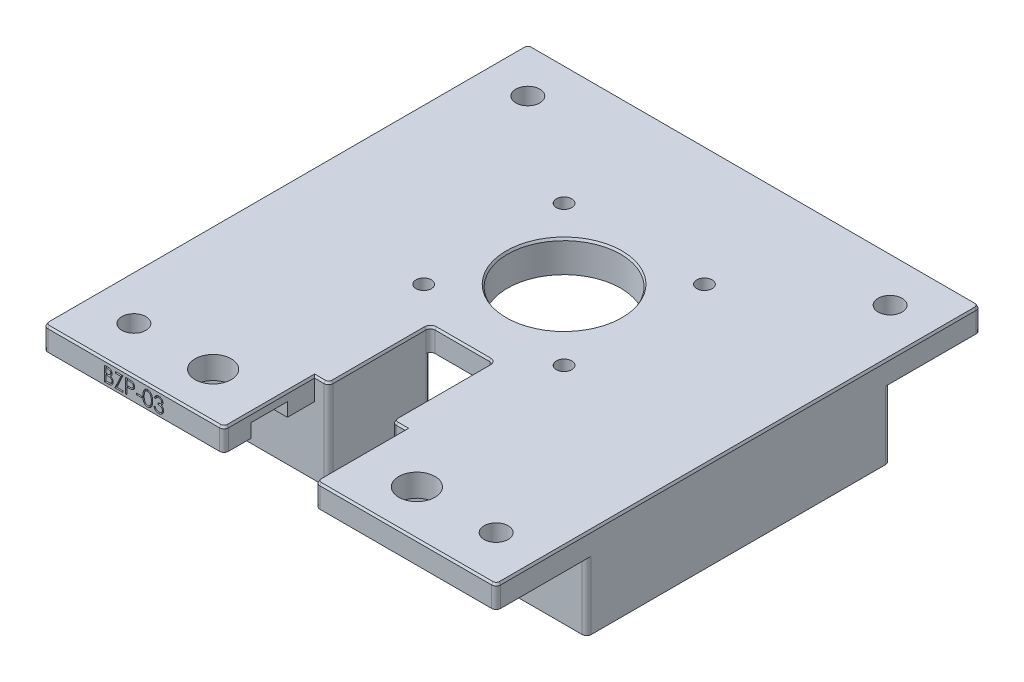
from build123d import *
from OCP.BRepFilletAPI import BRepFilletAPI_MakeChamfer

# Parameters (mm, degrees)
SKETCH2_W                  = 100
SKETCH2_H                  = 107
BOSS_EXTRUDE1_DEPTH        = 5
CUT_EXTRUDE1_DEPTH         = 147.540096902
CUT_EXTRUDE1_DEPTH_BACK    = 147.540096902
SKETCH3_R                  = 12.5
SKETCH3_R_2                = 1.7
SKETCH3_R_3                = 4
M5_CLEARANCE_HOLE1_D       = 5.3
FILLET1_R                  = 1
BOSS_EXTRUDE2_DEPTH        = 15
FILLET3_R                  = 3
FILLET4_R                  = 1
CUT_EXTRUDE2_DEPTH         = 4
CUT_EXTRUDE2_DEPTH_BACK    = 4
SKETCH12_R                 = 12.5
SKETCH12_R_2               = 1.7
BOSS_EXTRUDE3_DEPTH        = 2
CHAMFER2_SIZE              = 0.5
SKETCH10_W                 = 1.221153846
SKETCH10_H                 = 0.325641026
PART_NUM_DEPTH             = 0.4
PRINTABILITY_CHAMFER_SIZE  = 0.5
PRINTABILITY_CHAMFER_SIZE2 = 0.288675135


with BuildPart() as part:
    # Sketch2 → Boss-Extrude1 (new body)
    with BuildSketch(Plane(origin=(0, 0, 0), x_dir=(1, 0, 0), z_dir=(0, 1, 0))):
        with Locations((50, 53.5)):
            Rectangle(SKETCH2_W, SKETCH2_H)
    extrude(amount=BOSS_EXTRUDE1_DEPTH)

    # Sketch3 → Cut-Extrude1 (cut, two sides: drawn at the far end of the back side and taken through both)
    with BuildSketch(Plane(origin=(0, 5, 0), x_dir=(1, 0, 0), z_dir=(0, 1, 0)).offset(-CUT_EXTRUDE1_DEPTH_BACK)):
        with Locations((50, 65)):
            Circle(SKETCH3_R)
        with Locations((65.5, 49.5)):
            Circle(SKETCH3_R_2)
        with Locations((34.5, 49.5)):
            Circle(SKETCH3_R_2)
        with Locations((65.5, 80.5)):
            Circle(SKETCH3_R_2)
        with Locations((34.5, 80.5)):
            Circle(SKETCH3_R_2)
        with Locations((27.5, 10)):
            Circle(SKETCH3_R_3)
        with Locations((72.5, 10)):
            Circle(SKETCH3_R_3)
        Polygon((39.9, 0), (39.9, 20), (43, 20), (43, 42.5), (57, 42.5), (57, 20), (60.1, 20), (60.1, 0), align=None)
    extrude(amount=CUT_EXTRUDE1_DEPTH + CUT_EXTRUDE1_DEPTH_BACK, mode=Mode.SUBTRACT)

    # M5 Clearance Hole1 (through all)
    with Locations(Plane(origin=(0, 5, 0), x_dir=(1, 0, 0), z_dir=(0, 1, 0))):
        with Locations((10, 97), (10, 10), (90, 10), (90, 97)):
            Hole(M5_CLEARANCE_HOLE1_D / 2)

    # Fillet1
    fillet1_edges = [part.edges().sort_by_distance(p)[0] for p in [
        (60.1, 2.5, 0),
        (39.9, 2.5, 0),
        (0, 2.5, -107),
        (100, 2.5, -107),
        (100, 2.5, 0),
        (0, 2.5, 0),
        (57, 2.5, -42.5),
        (43, 2.5, -42.5),
    ]]
    fillet(fillet1_edges, radius=FILLET1_R)

    # Sketch7 → Boss-Extrude2 (add)
    with BuildSketch(Plane.XZ):
        Polygon((57, -20), (100, -20), (100, -87), (84, -87), (84, -82), (95, -82), (95, -25), (62, -25), (62, -42.5), (57, -42.5), (57, -25), align=None)
        Polygon((43, -25), (43, -20), (0, -20), (0, -87), (16, -87), (16, -82), (5, -82), (5, -25), (38, -25), (38, -42.5), (43, -42.5), align=None)
    extrude(amount=BOSS_EXTRUDE2_DEPTH)

    # Fillet3
    fillet3_edges = [part.edges().sort_by_distance(p)[0] for p in [
        (5, -7.5, -82),
        (95, -7.5, -82),
        (5, -7.5, -25),
        (38, -7.5, -25),
        (95, -7.5, -25),
        (62, -7.5, -25),
    ]]
    fillet(fillet3_edges, radius=FILLET3_R)

    # Fillet4
    fillet4_edges = [part.edges().sort_by_distance(p)[0] for p in [
        (100, -7.5, -87),
        (100, -7.5, -20),
        (43, -5, -20),
        (57, -5, -20),
        (84, -7.5, -87),
        (84, -7.5, -82),
        (0, -7.5, -20),
        (0, -7.5, -87),
        (16, -7.5, -87),
        (16, -7.5, -82),
        (38, -7.5, -42.5),
        (62, -7.5, -42.5),
        (57, -7.5, -42.5),
        (43, -7.5, -42.5),
    ]]
    fillet(fillet4_edges, radius=FILLET4_R)

    # Sketch9 → Cut-Extrude2 (cut, two sides: drawn at the far end of the back side and taken through both)
    with BuildSketch(Plane.XY.offset(-10).offset(-CUT_EXTRUDE2_DEPTH_BACK)):
        Polygon((39.9, 0), (39.9, 3), (36.9, 0), align=None)
        Polygon((60.1, 0), (63.1, 0), (60.1, 3), align=None)
    extrude(amount=CUT_EXTRUDE2_DEPTH + CUT_EXTRUDE2_DEPTH_BACK, mode=Mode.SUBTRACT)

    # Sketch12 → Boss-Extrude3 (add)
    with BuildSketch(Plane.XZ):
        with BuildLine():
            Line((34.5, -85.5), (65.5, -85.5))
            ThreePointArc((65.5, -85.5), (69.035533906, -84.035533906), (70.5, -80.5))
            Line((70.5, -80.5), (70.5, -49.5))
            ThreePointArc((70.5, -49.5), (69.035533906, -45.964466094), (65.5, -44.5))
            Line((65.5, -44.5), (34.5, -44.5))
            ThreePointArc((34.5, -44.5), (30.964466094, -45.964466094), (29.5, -49.5))
            Line((29.5, -49.5), (29.5, -80.5))
            ThreePointArc((29.5, -80.5), (30.964466094, -84.035533906), (34.5, -85.5))
        make_face()
        with Locations((50, -65)):
            Circle(SKETCH12_R, mode=Mode.SUBTRACT)
        with Locations((34.5, -49.5)):
            Circle(SKETCH12_R_2, mode=Mode.SUBTRACT)
        with Locations((65.5, -49.5)):
            Circle(SKETCH12_R_2, mode=Mode.SUBTRACT)
        with Locations((65.5, -80.5)):
            Circle(SKETCH12_R_2, mode=Mode.SUBTRACT)
        with Locations((34.5, -80.5)):
            Circle(SKETCH12_R_2, mode=Mode.SUBTRACT)
    extrude(amount=BOSS_EXTRUDE3_DEPTH)

    # Chamfer2
    chamfer2_edges = [part.edges().sort_by_distance(p)[0] for p in [
        (50, 0, -85.5),
        (69.035533906, 0, -84.035533906),
        (30.964466094, 0, -84.035533906),
        (70.5, 0, -65),
        (29.5, 0, -65),
        (69.035533906, 0, -45.964466094),
        (30.964466094, 0, -45.964466094),
        (50, 0, -44.5),
    ]]
    chamfer(chamfer2_edges, length=CHAMFER2_SIZE)

    # Sketch10 → Part Num (cut)
    # profile 1 of 6: a face of its own
    with BuildSketch(Plane(origin=(0, 5, 0), x_dir=(1, 0, 0), z_dir=(0, 0, -1))):
        with BuildLine():
            Line((13.559294872, 1.225), (14.178776042, 1.225))
            add(Edge.make_bspline(
                [(14.178776042, 1.225), (14.209100925, 1.225156921), (14.267878096, 1.225461072), (14.353342091, 1.230287737), (14.433418884, 1.236704332), (14.50796697, 1.247467824), (14.577471422, 1.258628146), (14.641226624, 1.275008826), (14.699766605, 1.293101885), (14.77006114, 1.32094051), (14.849819923, 1.364174247), (14.93554569, 1.428293986), (15.010063757, 1.505168377), (15.073426203, 1.592772808), (15.124275913, 1.68914761), (15.160598035, 1.792219247), (15.18393275, 1.900253662), (15.186302411, 1.974321243), (15.1875, 2.011753806)],
                knots=[0, 0, 0, 0, 1.00128172, 1.940733171, 2.826250472, 3.653024905, 4.427672124, 5.149348099, 5.824709082, 6.450061444, 7.643590664, 8.808605388, 9.972104426, 11.165284501, 12.367876273, 13.557044126, 14.765369432, 16, 16, 16, 16], degree=3))
            add(Edge.make_bspline(
                [(15.1875, 2.011753806), (15.186521793, 2.046821674), (15.184599523, 2.115733341), (15.165820503, 2.216186738), (15.137474028, 2.312110727), (15.096568342, 2.402580893), (15.044410156, 2.486802276), (14.980951884, 2.563338275), (14.905707767, 2.630686236), (14.849214068, 2.668166335), (14.820517829, 2.687204527)],
                knots=[0, 0, 0, 0, 1.044356178, 2.052258378, 3.035953355, 4.020338374, 5.002448483, 5.980768927, 6.974322109, 8, 8, 8, 8], degree=3))
            add(Edge.make_bspline(
                [(14.820517829, 2.687204527), (14.856588776, 2.701045853), (14.925601434, 2.727527739), (15.020694663, 2.77452874), (15.102651573, 2.825257679), (15.172528364, 2.880086384), (15.231080178, 2.940805168), (15.283240485, 3.005814962), (15.327507334, 3.077379834), (15.365276832, 3.153949009), (15.395196276, 3.235117005), (15.415964531, 3.320276589), (15.429135825, 3.40846321), (15.430858211, 3.468399436), (15.431730769, 3.498763021)],
                knots=[0, 0, 0, 0, 1.272200328, 2.434034374, 3.488177493, 4.442517805, 5.351202203, 6.260825393, 7.183200622, 8.11705787, 9.069326169, 10.026320267, 11.000137371, 12, 12, 12, 12], degree=3))
            add(Edge.make_bspline(
                [(15.431730769, 3.498763021), (15.430844545, 3.529757203), (15.429100875, 3.590739126), (15.41623883, 3.680324877), (15.394454675, 3.765933729), (15.364470848, 3.848135531), (15.325385419, 3.926448851), (15.27816616, 4.001489144), (15.22149309, 4.072144303), (15.157673639, 4.13943962), (15.086469492, 4.20097828), (15.008008094, 4.253862582), (14.924300327, 4.299540927), (14.834199915, 4.336263754), (14.73834618, 4.365011011), (14.636716669, 4.384886817), (14.529369089, 4.398332925), (14.455699174, 4.399434879), (14.41791867, 4.4)],
                knots=[0, 0, 0, 0, 0.978522333, 1.925270105, 2.85076145, 3.763600118, 4.682725947, 5.609499657, 6.557784645, 7.537954401, 8.534920712, 9.522742111, 10.520247711, 11.5409147, 12.58930695, 13.675078472, 14.807699069, 16, 16, 16, 16], degree=3))
            Line((14.41791867, 4.4), (13.559294872, 4.4))
            Line((13.559294872, 4.4), (13.559294872, 1.225))
        make_face()
        with BuildLine():
            Line((13.844230769, 1.550641026), (13.844230769, 2.568269231))
            Line((13.844230769, 2.568269231), (14.035672075, 2.568269231))
            add(Edge.make_bspline(
                [(14.035672075, 2.568269231), (14.063656592, 2.567909462), (14.11772838, 2.567214317), (14.196240951, 2.565160292), (14.26893695, 2.559660798), (14.336066859, 2.553844164), (14.397180797, 2.544887778), (14.452483186, 2.53392756), (14.502471365, 2.522437825), (14.560090796, 2.502841292), (14.625441111, 2.474182831), (14.694618633, 2.428618136), (14.756881512, 2.375864071), (14.808244794, 2.313289506), (14.85100659, 2.245714635), (14.879796447, 2.172635549), (14.899869806, 2.096570575), (14.901656804, 2.044112234), (14.902564103, 2.017477965)],
                knots=[0, 0, 0, 0, 1.156584208, 2.234756387, 3.244705828, 4.168772894, 5.018724976, 5.795346628, 6.498686023, 7.135894168, 8.308330183, 9.43588092, 10.547699294, 11.667188675, 12.76860303, 13.837480448, 14.902040606, 16, 16, 16, 16], degree=3))
            add(Edge.make_bspline(
                [(14.902564103, 2.017477965), (14.902121598, 1.999845497), (14.901253578, 1.965257486), (14.893070408, 1.914864741), (14.88177773, 1.866910763), (14.863153292, 1.822688306), (14.841088146, 1.780644538), (14.8128059, 1.742107543), (14.780193868, 1.706033348), (14.742172327, 1.673388889), (14.698896699, 1.64386386), (14.648996117, 1.619285683), (14.593827254, 1.597443357), (14.532239669, 1.580886362), (14.465460128, 1.566512255), (14.392469815, 1.557448022), (14.313708618, 1.551625016), (14.259137987, 1.550976338), (14.230929487, 1.550641026)],
                knots=[0, 0, 0, 0, 0.911412742, 1.787835618, 2.63643285, 3.453173233, 4.262886967, 5.08783453, 5.918594724, 6.773969545, 7.67442701, 8.62112486, 9.645634318, 10.739428598, 11.916091468, 13.177237585, 14.540865421, 16, 16, 16, 16], degree=3))
            Line((14.230929487, 1.550641026), (13.844230769, 1.550641026))
        make_face(mode=Mode.SUBTRACT)
        with BuildLine():
            Line((13.844230769, 2.893910256), (13.844230769, 4.074358974))
            Line((13.844230769, 4.074358974), (14.250010016, 4.074358974))
            add(Edge.make_bspline(
                [(14.250010016, 4.074358974), (14.279052852, 4.073977387), (14.335029091, 4.073241928), (14.415910647, 4.071496784), (14.490477252, 4.065022306), (14.55934975, 4.058814977), (14.622209475, 4.048674015), (14.679667845, 4.038854064), (14.730412484, 4.024403522), (14.789786642, 4.00451932), (14.856196042, 3.97274173), (14.92871824, 3.926010062), (14.99259521, 3.869087446), (15.046790344, 3.803544285), (15.091851221, 3.733014359), (15.123024449, 3.657358853), (15.143222926, 3.579104783), (15.145601826, 3.52559752), (15.146794872, 3.498763021)],
                knots=[0, 0, 0, 0, 1.16016216, 2.236059617, 3.229676189, 4.14889023, 4.996733752, 5.772278665, 6.474820656, 7.101410824, 8.271817372, 9.403828207, 10.537358096, 11.673541442, 12.791884111, 13.865947414, 14.929748409, 16, 16, 16, 16], degree=3))
            add(Edge.make_bspline(
                [(15.146794872, 3.498763021), (15.146551335, 3.481984403), (15.146068189, 3.448697807), (15.138473614, 3.399825141), (15.127934288, 3.352248989), (15.11240228, 3.306615593), (15.093612775, 3.262139153), (15.06882463, 3.220266851), (15.040863787, 3.17921625), (14.997556668, 3.126707986), (14.933707118, 3.066939881), (14.842942728, 3.009154389), (14.740317485, 2.961797377), (14.665709188, 2.941777202), (14.62716847, 2.931435296)],
                knots=[0, 0, 0, 0, 0.723354195, 1.435040621, 2.129761981, 2.824182007, 3.512608497, 4.209435533, 4.920062464, 5.654614313, 7.143585817, 8.671381114, 10.280521501, 12, 12, 12, 12], degree=3))
            add(Edge.make_bspline(
                [(14.62716847, 2.931435296), (14.611720661, 2.928300831), (14.578226627, 2.921504664), (14.523609473, 2.914335298), (14.461047138, 2.907904144), (14.390807025, 2.903271916), (14.31260978, 2.898299301), (14.226480524, 2.896434267), (14.132358367, 2.894157894), (14.067050921, 2.893994914), (14.033128005, 2.893910256)],
                knots=[0, 0, 0, 0, 0.634452549, 1.375623993, 2.216454381, 3.166361212, 4.209414599, 5.370755378, 6.634280627, 8, 8, 8, 8], degree=3))
            Line((14.033128005, 2.893910256), (13.844230769, 2.893910256))
        make_face(mode=Mode.SUBTRACT)
    # profile 2 of 6: a face of its own
    with BuildSketch(Plane(origin=(0, 5, 0), x_dir=(1, 0, 0), z_dir=(0, 0, -1))):
        Polygon((15.920192308, 1.550641026), (15.920192308, 1.225), (17.589102564, 1.225), (16.257281651, 4.074358974), (17.548397436, 4.074358974), (17.548397436, 4.4), (15.798076923, 4.4), (17.129897837, 1.550641026), align=None)
    # profile 3 of 6: a face of its own
    with BuildSketch(Plane(origin=(0, 5, 0), x_dir=(1, 0, 0), z_dir=(0, 0, -1))):
        with BuildLine():
            Line((18.199679487, 1.225), (18.822340745, 1.225))
            add(Edge.make_bspline(
                [(18.822340745, 1.225), (18.865167781, 1.225047077), (18.947226285, 1.22513728), (19.064896371, 1.227872085), (19.171766628, 1.23152487), (19.267606616, 1.236588444), (19.352711219, 1.242572494), (19.426695341, 1.250965415), (19.49014051, 1.259728683), (19.528155646, 1.268638102), (19.545492788, 1.272701322)],
                knots=[0, 0, 0, 0, 1.415646017, 2.712440637, 3.8905458, 4.950247383, 5.884950622, 6.709939814, 7.411656543, 8, 8, 8, 8], degree=3))
            add(Edge.make_bspline(
                [(19.545492788, 1.272701322), (19.56743964, 1.278708558), (19.610816194, 1.290581476), (19.673321301, 1.314358446), (19.732780513, 1.342564145), (19.789442546, 1.374662729), (19.842336712, 1.412170044), (19.89311447, 1.452921295), (19.940710937, 1.498564559), (19.984407421, 1.549039743), (20.024894101, 1.6026933), (20.058784353, 1.660893367), (20.08871078, 1.721620959), (20.112032716, 1.78635876), (20.130364655, 1.854252238), (20.143715825, 1.9254781), (20.152296908, 1.999882695), (20.153111145, 2.050738752), (20.153525641, 2.076627604)],
                knots=[0, 0, 0, 0, 0.999333726, 1.975119402, 2.933498163, 3.889020618, 4.832249799, 5.779334906, 6.747801194, 7.724875447, 8.710438469, 9.696133548, 10.679360639, 11.681339199, 12.714023775, 13.766351759, 14.862936069, 16, 16, 16, 16], degree=3))
            add(Edge.make_bspline(
                [(20.153525641, 2.076627604), (20.153143349, 2.102733159), (20.152395368, 2.15381044), (20.143418023, 2.228534326), (20.131325635, 2.299943151), (20.11273188, 2.367878582), (20.08837902, 2.431937173), (20.059811229, 2.493097862), (20.025354741, 2.550320136), (19.985762645, 2.603811736), (19.941719413, 2.65362287), (19.893411391, 2.699392577), (19.841033604, 2.740852941), (19.784752512, 2.77809691), (19.724019435, 2.810260821), (19.659755482, 2.839069233), (19.591402071, 2.863263695), (19.544101362, 2.875990965), (19.520052083, 2.882461939)],
                knots=[0, 0, 0, 0, 1.121902311, 2.195077645, 3.232258892, 4.234102512, 5.217864754, 6.176164875, 7.132989551, 8.084763148, 9.034132444, 9.988522005, 10.94243251, 11.903244335, 12.886203696, 13.894208494, 14.929344452, 16, 16, 16, 16], degree=3))
            add(Edge.make_bspline(
                [(19.520052083, 2.882461939), (19.500160632, 2.886688777), (19.456567361, 2.895952137), (19.384778108, 2.906363894), (19.301151672, 2.914902673), (19.205972588, 2.922871129), (19.0990189, 2.927093415), (18.980535909, 2.932051068), (18.850122628, 2.934390313), (18.759163431, 2.934538182), (18.711673678, 2.934615385)],
                knots=[0, 0, 0, 0, 0.601372724, 1.317943291, 2.144091499, 3.08771165, 4.142394186, 5.309582461, 6.595334295, 8, 8, 8, 8], degree=3))
            Line((18.711673678, 2.934615385), (18.484615385, 2.934615385))
            Line((18.484615385, 2.934615385), (18.484615385, 4.4))
            Line((18.484615385, 4.4), (18.199679487, 4.4))
            Line((18.199679487, 4.4), (18.199679487, 1.225))
        make_face()
        with BuildLine():
            Line((18.484615385, 1.550641026), (18.484615385, 2.608974359))
            Line((18.484615385, 2.608974359), (19.040494792, 2.615970553))
            add(Edge.make_bspline(
                [(19.040494792, 2.615970553), (19.067636896, 2.61598845), (19.120034167, 2.616022999), (19.195928006, 2.61234584), (19.266170464, 2.608345506), (19.330865252, 2.601876016), (19.389717084, 2.593985255), (19.44286845, 2.583435268), (19.490743523, 2.572674962), (19.545890306, 2.554003923), (19.607660485, 2.525836289), (19.674703005, 2.483764418), (19.73198534, 2.430764439), (19.781136336, 2.370529413), (19.81998684, 2.303449897), (19.848143485, 2.231877993), (19.865329717, 2.156085468), (19.86748988, 2.104277864), (19.868589744, 2.077899639)],
                knots=[0, 0, 0, 0, 1.160501667, 2.240324542, 3.248665471, 4.168823117, 5.020172044, 5.786515869, 6.485785279, 7.116517804, 8.272762037, 9.381837012, 10.485674779, 11.594342068, 12.695271952, 13.786226926, 14.872841088, 16, 16, 16, 16], degree=3))
            add(Edge.make_bspline(
                [(19.868589744, 2.077899639), (19.867440811, 2.052375996), (19.865156875, 2.001638153), (19.84828545, 1.927242072), (19.819688653, 1.856483828), (19.781104663, 1.789935981), (19.733131498, 1.729861051), (19.67698839, 1.678042247), (19.613548837, 1.636100993), (19.554996767, 1.608181099), (19.502597275, 1.591808252), (19.457302681, 1.579987886), (19.405900244, 1.571835631), (19.348876426, 1.564035455), (19.286304234, 1.557739017), (19.217785787, 1.553366568), (19.143549316, 1.550834445), (19.092014254, 1.55070706), (19.065299479, 1.550641026)],
                knots=[0, 0, 0, 0, 1.12039168, 2.227199994, 3.330242575, 4.460839274, 5.593542475, 6.693949254, 7.801736126, 8.92216649, 9.528704869, 10.210659466, 10.975987387, 11.81211542, 12.738540127, 13.736887663, 14.826846554, 16, 16, 16, 16], degree=3))
            Line((19.065299479, 1.550641026), (18.484615385, 1.550641026))
        make_face(mode=Mode.SUBTRACT)
    # profile 4 of 6: a face of its own
    with BuildSketch(Plane(origin=(0, 5, 0), x_dir=(1, 0, 0), z_dir=(0, 0, -1))):
        with Locations((21.130448718, 3.178846154)):
            Rectangle(SKETCH10_W, SKETCH10_H)
    # profile 5 of 6: a face of its own
    with BuildSketch(Plane(origin=(0, 5, 0), x_dir=(1, 0, 0), z_dir=(0, 0, -1))):
        with BuildLine():
            add(Edge.make_bspline(
                [(21.98525641, 2.813772035), (21.98555397, 2.762883691), (21.986131983, 2.664032348), (21.992562193, 2.519991994), (22.00324411, 2.384863731), (22.017883016, 2.258641095), (22.035697459, 2.141291485), (22.059478684, 2.033128559), (22.086523044, 1.933651525), (22.117867421, 1.842536591), (22.153233633, 1.758554174), (22.191732091, 1.680158454), (22.234864124, 1.607443081), (22.280257631, 1.539336681), (22.329501301, 1.476524658), (22.382423887, 1.419289299), (22.438559244, 1.366743659), (22.498172988, 1.319751782), (22.560696927, 1.278804629), (22.62428152, 1.241686961), (22.69074033, 1.212325862), (22.758434115, 1.187218741), (22.827908268, 1.167330508), (22.899193054, 1.15349668), (22.97235244, 1.144841944), (23.021728688, 1.144011104), (23.046769832, 1.143589744)],
                knots=[0, 0, 0, 0, 1.64625301, 3.197870201, 4.6634513, 6.030635694, 7.308242971, 8.501545196, 9.611429483, 10.641742253, 11.616230371, 12.55791849, 13.464870342, 14.34944951, 15.20427819, 16.044004467, 16.869007726, 17.689551165, 18.496129964, 19.285613293, 20.0683943, 20.843080271, 21.620342827, 22.403213977, 23.190190624, 24, 24, 24, 24], degree=3))
            add(Edge.make_bspline(
                [(23.046769832, 1.143589744), (23.072032833, 1.143940127), (23.122297314, 1.144637268), (23.196342984, 1.15444994), (23.269098905, 1.16711544), (23.339461226, 1.187428816), (23.408760362, 1.211736404), (23.475272984, 1.243809882), (23.541347339, 1.278692279), (23.603981757, 1.321245869), (23.665047641, 1.368274589), (23.722290531, 1.421664209), (23.777173708, 1.479937166), (23.827624258, 1.544393116), (23.875804419, 1.61404376), (23.919885225, 1.68947297), (23.960783476, 1.770513584), (23.99926795, 1.856789911), (24.032921607, 1.950606524), (24.062842398, 2.051378265), (24.087367548, 2.16001767), (24.107649417, 2.275919549), (24.123392008, 2.399658079), (24.134849199, 2.530982551), (24.140903329, 2.669975122), (24.142043239, 2.765005487), (24.142628205, 2.813772035)],
                knots=[0, 0, 0, 0, 0.810910589, 1.61342667, 2.396193133, 3.181089899, 3.963115317, 4.752255436, 5.550715454, 6.36105385, 7.181178335, 8.024612154, 8.872680183, 9.750181803, 10.651284446, 11.591556747, 12.554036451, 13.566402641, 14.62422919, 15.753422176, 16.94128843, 18.199818041, 19.531985927, 20.947085226, 22.433341622, 24, 24, 24, 24], degree=3))
            add(Edge.make_bspline(
                [(24.142628205, 2.813772035), (24.142029642, 2.86232526), (24.140860754, 2.957141006), (24.134986983, 3.0955172), (24.123084878, 3.226125067), (24.108578365, 3.349153833), (24.087662811, 3.46444268), (24.06437755, 3.572610751), (24.034675892, 3.672641678), (24.001820493, 3.765654117), (23.963871504, 3.851564969), (23.923281266, 3.932271074), (23.878542433, 4.007272206), (23.831286761, 4.077364331), (23.779881082, 4.141267492), (23.725740637, 4.200192302), (23.667942403, 4.253674679), (23.606562168, 4.301258682), (23.543335742, 4.344132824), (23.477248506, 4.380259022), (23.409847501, 4.411753694), (23.34043167, 4.437071727), (23.269443657, 4.457085732), (23.196627822, 4.470710162), (23.122287411, 4.48031367), (23.072029521, 4.481043462), (23.046769832, 4.481410256)],
                knots=[0, 0, 0, 0, 1.561431216, 3.049195289, 4.452146966, 5.778046447, 7.031138842, 8.218704273, 9.334037798, 10.384210803, 11.388620812, 12.352076869, 13.287433199, 14.19507451, 15.06813243, 15.922055533, 16.766344942, 17.596869952, 18.417486629, 19.220035357, 20.016159057, 20.807716045, 21.59340902, 22.384936649, 23.188266813, 24, 24, 24, 24], degree=3))
            add(Edge.make_bspline(
                [(23.046769832, 4.481410256), (23.021729561, 4.480985162), (22.972355034, 4.480146959), (22.899183041, 4.471546161), (22.828001615, 4.457521158), (22.758668454, 4.438475275), (22.691041682, 4.414269078), (22.625783708, 4.383479729), (22.562032943, 4.347768738), (22.500079347, 4.307141318), (22.441107289, 4.260581379), (22.384765226, 4.209094936), (22.332527872, 4.151355125), (22.283623806, 4.088283519), (22.237853656, 4.020005674), (22.194904275, 3.946733625), (22.156523059, 3.867574197), (22.120354959, 3.783135875), (22.088472503, 3.691351453), (22.060633331, 3.591533526), (22.037162377, 3.483001243), (22.018467433, 3.365749411), (22.003152106, 3.239959542), (21.992572724, 3.105431183), (21.986135198, 2.962452483), (21.985554685, 2.864236572), (21.98525641, 2.813772035)],
                knots=[0, 0, 0, 0, 0.810976328, 1.599087026, 2.383086309, 3.159618043, 3.926613167, 4.707144544, 5.494386734, 6.292609454, 7.104690378, 7.92621526, 8.762510248, 9.62398222, 10.509836085, 11.424023232, 12.373226806, 13.358118208, 14.398657954, 15.5185989, 16.713620699, 17.994156382, 19.364120462, 20.818119981, 22.365111093, 24, 24, 24, 24], degree=3))
        make_face()
        with BuildLine():
            add(Edge.make_bspline(
                [(22.270192308, 2.8125), (22.270303039, 2.854907579), (22.270517947, 2.937212362), (22.275969792, 3.056603995), (22.283558203, 3.168147672), (22.293104865, 3.271799855), (22.307402335, 3.367198295), (22.323623727, 3.454739556), (22.343080171, 3.534261741), (22.366214564, 3.606459314), (22.392565497, 3.672356193), (22.421290351, 3.733703321), (22.452405577, 3.791246897), (22.486625049, 3.844779303), (22.524439036, 3.894001546), (22.565003515, 3.939147401), (22.608554357, 3.980033045), (22.668828635, 4.02855602), (22.748014823, 4.079288538), (22.848296213, 4.122923324), (22.95138528, 4.150522248), (23.021375705, 4.154022264), (23.056310096, 4.155769231)],
                knots=[0, 0, 0, 0, 1.459193451, 2.832007961, 4.111736495, 5.306635028, 6.412683014, 7.430020708, 8.369596877, 9.227877302, 10.036669781, 10.810175692, 11.557788084, 12.286326232, 12.994037279, 13.69140682, 14.37267704, 15.047194847, 16.352618509, 17.594157723, 18.799169539, 20, 20, 20, 20], degree=3))
            add(Edge.make_bspline(
                [(23.056310096, 4.155769231), (23.091445086, 4.15423738), (23.161590435, 4.151179113), (23.264609334, 4.124487765), (23.363793146, 4.081096109), (23.44206796, 4.031522171), (23.501452796, 3.984009028), (23.544016751, 3.943546211), (23.583079196, 3.898226589), (23.620129066, 3.849332926), (23.654109723, 3.795926979), (23.685009876, 3.738266698), (23.713206907, 3.676191642), (23.729271542, 3.632857667), (23.737484976, 3.610702123)],
                knots=[0, 0, 0, 0, 1.353621445, 2.702441307, 4.075953605, 5.516772412, 6.261413105, 7.007624062, 7.778524365, 8.566925914, 9.372323995, 10.217594641, 11.088702136, 12, 12, 12, 12], degree=3))
            add(Edge.make_bspline(
                [(23.737484976, 3.610702123), (23.747056937, 3.582372288), (23.766492122, 3.524850574), (23.791539946, 3.435620689), (23.81126613, 3.342001039), (23.829012897, 3.244551112), (23.841126026, 3.14255224), (23.850875828, 3.03632002), (23.856618666, 2.925774356), (23.857330547, 2.850667471), (23.857692308, 2.8125)],
                knots=[0, 0, 0, 0, 0.884706709, 1.796334032, 2.740027952, 3.714592787, 4.726048262, 5.777819803, 6.87074269, 8, 8, 8, 8], degree=3))
            add(Edge.make_bspline(
                [(23.857692308, 2.8125), (23.857293324, 2.774333349), (23.856512731, 2.699661985), (23.851384165, 2.590417712), (23.843142984, 2.486477881), (23.831988727, 2.3877482), (23.816676293, 2.294404394), (23.798287574, 2.206312902), (23.776728944, 2.12349743), (23.752000438, 2.045744551), (23.724132152, 1.973333218), (23.693344682, 1.906107553), (23.66049502, 1.843704976), (23.624792036, 1.786326202), (23.586740867, 1.733636423), (23.544975229, 1.686848523), (23.502148043, 1.643686402), (23.441238722, 1.595298485), (23.362146126, 1.54557191), (23.263049334, 1.501055337), (23.160488426, 1.474709227), (23.091011168, 1.471055605), (23.056310096, 1.469230769)],
                knots=[0, 0, 0, 0, 1.313528337, 2.569860077, 3.762944266, 4.901481389, 5.988248151, 7.017139294, 7.997571128, 8.932104357, 9.823695246, 10.66607014, 11.475539426, 12.248954257, 12.990316782, 13.708962568, 14.405488541, 15.08007697, 16.381737273, 17.610043218, 18.806313575, 20, 20, 20, 20], degree=3))
            add(Edge.make_bspline(
                [(23.056310096, 1.469230769), (23.021187248, 1.471057764), (22.950877566, 1.474715083), (22.847243755, 1.500962383), (22.747553725, 1.545255295), (22.668627803, 1.595359976), (22.608575961, 1.643498484), (22.565841998, 1.684583683), (22.525512289, 1.72930733), (22.487879452, 1.778306398), (22.453868763, 1.831736727), (22.422375361, 1.888863145), (22.393879682, 1.950119145), (22.367429284, 2.015979603), (22.34454036, 2.08829581), (22.323960549, 2.167802136), (22.308076031, 2.255912716), (22.293971975, 2.351759147), (22.283310912, 2.455534565), (22.276022679, 2.567342293), (22.270501389, 2.687150117), (22.270297398, 2.769879843), (22.270192308, 2.8125)],
                knots=[0, 0, 0, 0, 1.207779899, 2.417760083, 3.652287919, 4.947299644, 5.621638849, 6.297435916, 6.984320042, 7.691843698, 8.42018894, 9.161205785, 9.934506883, 10.743085206, 11.601138371, 12.542248028, 13.566483018, 14.679455109, 15.87477181, 17.154161492, 18.533899613, 20, 20, 20, 20], degree=3))
        make_face(mode=Mode.SUBTRACT)
    # profile 6 of 6: a face of its own
    with BuildSketch(Plane(origin=(0, 5, 0), x_dir=(1, 0, 0), z_dir=(0, 0, -1))):
        with BuildLine():
            Line((24.834615385, 1.957692308), (24.549679487, 1.957692308))
            add(Edge.make_bspline(
                [(24.549679487, 1.957692308), (24.557398865, 1.925731412), (24.572489618, 1.863250474), (24.603965274, 1.77398103), (24.638254598, 1.689504693), (24.679429, 1.611403254), (24.724340513, 1.538107107), (24.775796125, 1.471278687), (24.831421873, 1.409218354), (24.892948791, 1.354142774), (24.957472649, 1.30427012), (25.025902625, 1.261747746), (25.096861965, 1.225167979), (25.170842307, 1.195032483), (25.248063905, 1.172330758), (25.327828635, 1.155859941), (25.410345524, 1.145163716), (25.46635941, 1.14411981), (25.494801683, 1.143589744)],
                knots=[0, 0, 0, 0, 1.162005537, 2.271625781, 3.343758855, 4.383309926, 5.390229558, 6.379919256, 7.361854164, 8.333198761, 9.295911338, 10.242430842, 11.177959212, 12.116337295, 13.062827104, 14.020064771, 14.994644689, 16, 16, 16, 16], degree=3))
            add(Edge.make_bspline(
                [(25.494801683, 1.143589744), (25.536242456, 1.144840902), (25.618220059, 1.147315929), (25.738655108, 1.169916882), (25.854793723, 1.205681109), (25.965364683, 1.255096562), (26.068069976, 1.316045053), (26.159452088, 1.388584493), (26.23827238, 1.471315288), (26.304397994, 1.562694114), (26.356173172, 1.66035304), (26.394351525, 1.760864611), (26.41759405, 1.8639904), (26.420606269, 1.933620217), (26.422115385, 1.968504607)],
                knots=[0, 0, 0, 0, 1.083050992, 2.142477498, 3.193116406, 4.255571735, 5.30263384, 6.308962982, 7.297363603, 8.282367274, 9.249857812, 10.179914175, 11.08814088, 12, 12, 12, 12], degree=3))
            add(Edge.make_bspline(
                [(26.422115385, 1.968504607), (26.421059841, 2.002075057), (26.418994307, 2.067767217), (26.401455874, 2.163671718), (26.371940835, 2.254060884), (26.331056122, 2.339315224), (26.278132002, 2.418894186), (26.21402177, 2.492976815), (26.138272926, 2.561891694), (26.08086989, 2.601370073), (26.051317107, 2.621694712)],
                knots=[0, 0, 0, 0, 1.024540389, 2.004866551, 2.965041327, 3.920577974, 4.882998113, 5.874504559, 6.905732034, 8, 8, 8, 8], degree=3))
            add(Edge.make_bspline(
                [(26.051317107, 2.621694712), (26.085134678, 2.637944359), (26.152245653, 2.670191788), (26.242797943, 2.734438784), (26.326253713, 2.806796847), (26.37224838, 2.863894554), (26.395402644, 2.892638221)],
                knots=[0, 0, 0, 0, 1.015663554, 2.015584519, 3.001021554, 4, 4, 4, 4], degree=3))
            add(Edge.make_bspline(
                [(26.395402644, 2.892638221), (26.410686366, 2.913552667), (26.441003529, 2.955039069), (26.478319196, 3.021779679), (26.512558835, 3.089039089), (26.537758218, 3.159461853), (26.559504287, 3.230785867), (26.573812477, 3.304538463), (26.582997762, 3.38001893), (26.584287563, 3.431106227), (26.584935897, 3.456785857)],
                knots=[0, 0, 0, 0, 1.02516404, 2.033540309, 3.025129118, 4.011046665, 4.991655828, 5.976607087, 6.982917762, 8, 8, 8, 8], degree=3))
            add(Edge.make_bspline(
                [(26.584935897, 3.456785857), (26.583304199, 3.50124268), (26.58004848, 3.589947111), (26.55107349, 3.721036259), (26.50587617, 3.848939827), (26.442886212, 3.9718439), (26.36459923, 4.086486129), (26.271975081, 4.189355009), (26.164915139, 4.276971627), (26.046536528, 4.350826978), (25.917788951, 4.409356512), (25.780630452, 4.451531784), (25.635873104, 4.476831032), (25.5368801, 4.47986647), (25.486533454, 4.481410256)],
                knots=[0, 0, 0, 0, 0.955619592, 1.906742024, 2.874954321, 3.868585453, 4.869520953, 5.854611167, 6.836527075, 7.836578462, 8.849204403, 9.870874567, 10.917152508, 12, 12, 12, 12], degree=3))
            add(Edge.make_bspline(
                [(25.486533454, 4.481410256), (25.452590939, 4.480615793), (25.38580339, 4.479052555), (25.287580643, 4.468556229), (25.194021118, 4.448864353), (25.104216315, 4.424099093), (25.019521606, 4.389858347), (24.938718736, 4.349037035), (24.862161894, 4.300588347), (24.790305724, 4.244430807), (24.723226997, 4.181570839), (24.662634656, 4.110964163), (24.607858311, 4.033928543), (24.559246003, 3.949771033), (24.516593144, 3.858727345), (24.480817625, 3.76043265), (24.449581178, 3.655648973), (24.435029945, 3.582647423), (24.427564103, 3.545192308)],
                knots=[0, 0, 0, 0, 1.048603596, 2.063302207, 3.045874044, 3.999447474, 4.937100059, 5.862643889, 6.7929026, 7.7308982, 8.676022965, 9.627908155, 10.600123445, 11.591992905, 12.626222643, 13.701663232, 14.820785756, 16, 16, 16, 16], degree=3))
            Line((24.427564103, 3.545192308), (24.7125, 3.545192308))
            add(Edge.make_bspline(
                [(24.7125, 3.545192308), (24.719923414, 3.569638913), (24.7343626, 3.617189683), (24.758940999, 3.685624817), (24.786942932, 3.748361051), (24.816982567, 3.805858597), (24.848531586, 3.858683705), (24.883832982, 3.905439544), (24.920272135, 3.948179763), (24.947739834, 3.972259518), (24.961182893, 3.984044471)],
                knots=[0, 0, 0, 0, 1.198163088, 2.33053128, 3.407730985, 4.417276592, 5.372219308, 6.28897303, 7.162600585, 8, 8, 8, 8], degree=3))
            add(Edge.make_bspline(
                [(24.961182893, 3.984044471), (24.978961773, 3.997744237), (25.014464653, 4.02510148), (25.072281749, 4.060112774), (25.133300367, 4.090081604), (25.19802936, 4.114441525), (25.26647741, 4.13272696), (25.338366863, 4.145887956), (25.413815672, 4.154576259), (25.46530801, 4.155365773), (25.491621595, 4.155769231)],
                knots=[0, 0, 0, 0, 0.946083416, 1.889246487, 2.84504177, 3.809995578, 4.801312957, 5.829064617, 6.89060985, 8, 8, 8, 8], degree=3))
            add(Edge.make_bspline(
                [(25.491621595, 4.155769231), (25.521334103, 4.155211425), (25.579434347, 4.154120685), (25.664205636, 4.144060742), (25.74487747, 4.129473511), (25.820626591, 4.106656246), (25.892483761, 4.079283167), (25.958844919, 4.043446782), (26.021661002, 4.00297538), (26.079091788, 3.955899355), (26.130868451, 3.905015268), (26.175609207, 3.851031786), (26.214359819, 3.795622748), (26.245508845, 3.737495574), (26.270149186, 3.677220445), (26.286913176, 3.614571751), (26.298572112, 3.550077031), (26.299521434, 3.506235663), (26.3, 3.484134615)],
                knots=[0, 0, 0, 0, 1.216990249, 2.379719373, 3.493992396, 4.571561497, 5.616923107, 6.638958652, 7.655775068, 8.674704564, 9.676001865, 10.625896028, 11.54399481, 12.441854662, 13.322657739, 14.20572845, 15.095482574, 16, 16, 16, 16], degree=3))
            add(Edge.make_bspline(
                [(26.3, 3.484134615), (26.298608901, 3.454553331), (26.295833626, 3.395537954), (26.2747328, 3.308680601), (26.239714552, 3.224961531), (26.191643709, 3.145477116), (26.131724239, 3.072672258), (26.062788531, 3.007504063), (25.983365714, 2.953241512), (25.909851153, 2.915855325), (25.844565075, 2.890946386), (25.788807452, 2.873479463), (25.726329301, 2.859517057), (25.657881344, 2.846011084), (25.583174691, 2.834688567), (25.502142101, 2.825205505), (25.414750954, 2.817629488), (25.354252661, 2.814244393), (25.323076923, 2.8125)],
                knots=[0, 0, 0, 0, 1.070440979, 2.135555593, 3.216243406, 4.345886539, 5.486149072, 6.621334998, 7.769144672, 8.957074012, 9.598644492, 10.297969361, 11.070758978, 11.915404831, 12.824182859, 13.805940418, 14.869366021, 16, 16, 16, 16], degree=3))
            Line((25.323076923, 2.8125), (25.323076923, 2.486858974))
            add(Edge.make_bspline(
                [(25.323076923, 2.486858974), (25.362341989, 2.486093435), (25.439225713, 2.484594455), (25.551848877, 2.470198016), (25.659213948, 2.44683056), (25.759705995, 2.414206556), (25.850827129, 2.374489411), (25.93063631, 2.33002138), (25.996262388, 2.278720446), (26.048880731, 2.223011676), (26.087908327, 2.162883322), (26.116716194, 2.10049864), (26.133755439, 2.034697061), (26.136034119, 1.989799919), (26.137179487, 1.967232572)],
                knots=[0, 0, 0, 0, 1.321816535, 2.58820849, 3.816448615, 5.017641336, 6.139869627, 7.160068286, 8.085608132, 8.934319198, 9.728416342, 10.48890201, 11.240453369, 12, 12, 12, 12], degree=3))
            add(Edge.make_bspline(
                [(26.137179487, 1.967232572), (26.136811828, 1.950649247), (26.136080388, 1.917657509), (26.126487576, 1.869306799), (26.112738607, 1.822433522), (26.092764139, 1.777585363), (26.066931081, 1.734619752), (26.035676927, 1.693379766), (25.998922506, 1.653471599), (25.956906494, 1.615775425), (25.910015549, 1.5818482), (25.86013169, 1.551602552), (25.807060439, 1.526170268), (25.751147648, 1.505088632), (25.692091081, 1.48925808), (25.630201422, 1.477884175), (25.565351442, 1.470774889), (25.521108574, 1.469751173), (25.498617788, 1.469230769)],
                knots=[0, 0, 0, 0, 0.884246871, 1.759167212, 2.622361933, 3.489113179, 4.372562419, 5.294145153, 6.247651513, 7.265905295, 8.30305477, 9.334068495, 10.37719476, 11.441246459, 12.52060732, 13.637552802, 14.799054011, 16, 16, 16, 16], degree=3))
            add(Edge.make_bspline(
                [(25.498617788, 1.469230769), (25.462465438, 1.470490485), (25.391851489, 1.472951003), (25.290073173, 1.494577848), (25.195554124, 1.528843353), (25.123549674, 1.57021885), (25.070288827, 1.610921254), (25.031499425, 1.645937533), (24.994102467, 1.685638821), (24.959565446, 1.731114079), (24.925818828, 1.780799599), (24.893184844, 1.834969028), (24.862711698, 1.894394662), (24.844162195, 1.936184481), (24.834615385, 1.957692308)],
                knots=[0, 0, 0, 0, 1.4727372, 2.876598283, 4.222346151, 5.558423782, 6.24313385, 6.953189256, 7.68715613, 8.463578749, 9.278833271, 10.135787152, 11.040551781, 12, 12, 12, 12], degree=3))
        make_face()
    extrude(amount=PART_NUM_DEPTH, mode=Mode.SUBTRACT)

    # Printability Chamfer: one chamfer whose edges measure the first distance from different faces: ONE call of the kernel's chamfer builder (chamfer() names one face for all edges)
    printability_chamfer_edges_1 = [part.edges().sort_by_distance(p)[0] for p in [
        (59.05, 5, -20),
    ]]
    printability_chamfer_side_1 = [part.faces().sort_by_distance(p)[0] for p in [
        (78.173501199, -7.332134293, -20),
    ]]
    printability_chamfer_edges_2 = [part.edges().sort_by_distance(p)[0] for p in [
        (57.292893219, 5, -20.292893219),
    ]]
    printability_chamfer_side_2 = [part.faces().sort_by_distance(p)[0] for p in [
        (57.292893219, -5, -20.292893219),
    ]]
    printability_chamfer_edges_3 = [part.edges().sort_by_distance(p)[0] for p in [
        (57, 5, -31.25),
    ]]
    printability_chamfer_side_3 = [part.faces().sort_by_distance(p)[0] for p in [
        (57, -5, -31.25),
    ]]
    printability_chamfer_edges_4 = [part.edges().sort_by_distance(p)[0] for p in [
        (56.707106781, 5, -42.207106781),
    ]]
    printability_chamfer_side_4 = [part.faces().sort_by_distance(p)[0] for p in [
        (56.707106781, 2.5, -42.207106781),
    ]]
    printability_chamfer_edges_5 = [part.edges().sort_by_distance(p)[0] for p in [
        (50, 5, -42.5),
    ]]
    printability_chamfer_side_5 = [part.faces().sort_by_distance(p)[0] for p in [
        (50, 2.5, -42.5),
    ]]
    printability_chamfer_edges_6 = [part.edges().sort_by_distance(p)[0] for p in [
        (43.292893219, 5, -42.207106781),
    ]]
    printability_chamfer_side_6 = [part.faces().sort_by_distance(p)[0] for p in [
        (43.292893219, 2.5, -42.207106781),
    ]]
    printability_chamfer_edges_7 = [part.edges().sort_by_distance(p)[0] for p in [
        (43, 5, -31.25),
    ]]
    printability_chamfer_side_7 = [part.faces().sort_by_distance(p)[0] for p in [
        (43, -5, -31.25),
    ]]
    printability_chamfer_edges_8 = [part.edges().sort_by_distance(p)[0] for p in [
        (42.707106781, 5, -20.292893219),
    ]]
    printability_chamfer_side_8 = [part.faces().sort_by_distance(p)[0] for p in [
        (42.707106781, -5, -20.292893219),
    ]]
    printability_chamfer_edges_9 = [part.edges().sort_by_distance(p)[0] for p in [
        (40.95, 5, -20),
    ]]
    printability_chamfer_side_9 = [part.faces().sort_by_distance(p)[0] for p in [
        (21.826498801, -7.332134293, -20),
    ]]
    printability_chamfer_edges_10 = [part.edges().sort_by_distance(p)[0] for p in [
        (37.5, 5, -65),
    ]]
    printability_chamfer_side_10 = [part.faces().sort_by_distance(p)[0] for p in [
        (37.5, 2.5, -65),
    ]]
    printability_chamfer_edges_11 = [part.edges().sort_by_distance(p)[0] for p in [
        (60.1, 5, -10.5),
    ]]
    printability_chamfer_side_11 = [part.faces().sort_by_distance(p)[0] for p in [
        (60.1, 2.5, -1.196468827),
    ]]
    printability_chamfer_edges_12 = [part.edges().sort_by_distance(p)[0] for p in [
        (60.392893219, 5, -0.292893219),
    ]]
    printability_chamfer_side_12 = [part.faces().sort_by_distance(p)[0] for p in [
        (60.392893219, 2.5, -0.292893219),
    ]]
    printability_chamfer_edges_13 = [part.edges().sort_by_distance(p)[0] for p in [
        (80.05, 5, 0),
    ]]
    printability_chamfer_side_13 = [part.faces().sort_by_distance(p)[0] for p in [
        (80.05, 2.5, 0),
    ]]
    printability_chamfer_edges_14 = [part.edges().sort_by_distance(p)[0] for p in [
        (99.707106781, 5, -0.292893219),
    ]]
    printability_chamfer_side_14 = [part.faces().sort_by_distance(p)[0] for p in [
        (99.707106781, 2.5, -0.292893219),
    ]]
    printability_chamfer_edges_15 = [part.edges().sort_by_distance(p)[0] for p in [
        (100, 5, -53.5),
    ]]
    printability_chamfer_side_15 = [part.faces().sort_by_distance(p)[0] for p in [
        (100, -4, -53.5),
    ]]
    printability_chamfer_edges_16 = [part.edges().sort_by_distance(p)[0] for p in [
        (99.707106781, 5, -106.707106781),
    ]]
    printability_chamfer_side_16 = [part.faces().sort_by_distance(p)[0] for p in [
        (99.707106781, 2.5, -106.707106781),
    ]]
    printability_chamfer_edges_17 = [part.edges().sort_by_distance(p)[0] for p in [
        (50, 5, -107),
    ]]
    printability_chamfer_side_17 = [part.faces().sort_by_distance(p)[0] for p in [
        (50, 2.5, -107),
    ]]
    printability_chamfer_edges_18 = [part.edges().sort_by_distance(p)[0] for p in [
        (0.292893219, 5, -106.707106781),
    ]]
    printability_chamfer_side_18 = [part.faces().sort_by_distance(p)[0] for p in [
        (0.292893219, 2.5, -106.707106781),
    ]]
    printability_chamfer_edges_19 = [part.edges().sort_by_distance(p)[0] for p in [
        (0, 5, -53.5),
    ]]
    printability_chamfer_side_19 = [part.faces().sort_by_distance(p)[0] for p in [
        (0, -4, -53.5),
    ]]
    printability_chamfer_edges_20 = [part.edges().sort_by_distance(p)[0] for p in [
        (39.9, 5, -10.5),
    ]]
    printability_chamfer_side_20 = [part.faces().sort_by_distance(p)[0] for p in [
        (39.9, 2.5, -19.803531173),
    ]]
    printability_chamfer_edges_21 = [part.edges().sort_by_distance(p)[0] for p in [
        (0.292893219, 5, -0.292893219),
    ]]
    printability_chamfer_side_21 = [part.faces().sort_by_distance(p)[0] for p in [
        (0.292893219, 2.5, -0.292893219),
    ]]
    printability_chamfer_edges_22 = [part.edges().sort_by_distance(p)[0] for p in [
        (39.607106781, 5, -0.292893219),
    ]]
    printability_chamfer_side_22 = [part.faces().sort_by_distance(p)[0] for p in [
        (39.607106781, 2.5, -0.292893219),
    ]]
    printability_chamfer_edges_23 = [part.edges().sort_by_distance(p)[0] for p in [
        (19.95, 5, 0),
    ]]
    printability_chamfer_side_23 = [part.faces().sort_by_distance(p)[0] for p in [
        (19.95, 0.382283928, 0),
    ]]
    printability_chamfer = BRepFilletAPI_MakeChamfer(part.part.solid().wrapped)
    for e in printability_chamfer_edges_1:
        printability_chamfer.Add(PRINTABILITY_CHAMFER_SIZE, PRINTABILITY_CHAMFER_SIZE2, e.wrapped, printability_chamfer_side_1[0].wrapped)  # the first distance lies on this face
    for e in printability_chamfer_edges_2:
        printability_chamfer.Add(PRINTABILITY_CHAMFER_SIZE, PRINTABILITY_CHAMFER_SIZE2, e.wrapped, printability_chamfer_side_2[0].wrapped)  # the first distance lies on this face
    for e in printability_chamfer_edges_3:
        printability_chamfer.Add(PRINTABILITY_CHAMFER_SIZE, PRINTABILITY_CHAMFER_SIZE2, e.wrapped, printability_chamfer_side_3[0].wrapped)  # the first distance lies on this face
    for e in printability_chamfer_edges_4:
        printability_chamfer.Add(PRINTABILITY_CHAMFER_SIZE, PRINTABILITY_CHAMFER_SIZE2, e.wrapped, printability_chamfer_side_4[0].wrapped)  # the first distance lies on this face
    for e in printability_chamfer_edges_5:
        printability_chamfer.Add(PRINTABILITY_CHAMFER_SIZE, PRINTABILITY_CHAMFER_SIZE2, e.wrapped, printability_chamfer_side_5[0].wrapped)  # the first distance lies on this face
    for e in printability_chamfer_edges_6:
        printability_chamfer.Add(PRINTABILITY_CHAMFER_SIZE, PRINTABILITY_CHAMFER_SIZE2, e.wrapped, printability_chamfer_side_6[0].wrapped)  # the first distance lies on this face
    for e in printability_chamfer_edges_7:
        printability_chamfer.Add(PRINTABILITY_CHAMFER_SIZE, PRINTABILITY_CHAMFER_SIZE2, e.wrapped, printability_chamfer_side_7[0].wrapped)  # the first distance lies on this face
    for e in printability_chamfer_edges_8:
        printability_chamfer.Add(PRINTABILITY_CHAMFER_SIZE, PRINTABILITY_CHAMFER_SIZE2, e.wrapped, printability_chamfer_side_8[0].wrapped)  # the first distance lies on this face
    for e in printability_chamfer_edges_9:
        printability_chamfer.Add(PRINTABILITY_CHAMFER_SIZE, PRINTABILITY_CHAMFER_SIZE2, e.wrapped, printability_chamfer_side_9[0].wrapped)  # the first distance lies on this face
    for e in printability_chamfer_edges_10:
        printability_chamfer.Add(PRINTABILITY_CHAMFER_SIZE, PRINTABILITY_CHAMFER_SIZE2, e.wrapped, printability_chamfer_side_10[0].wrapped)  # the first distance lies on this face
    for e in printability_chamfer_edges_11:
        printability_chamfer.Add(PRINTABILITY_CHAMFER_SIZE, PRINTABILITY_CHAMFER_SIZE2, e.wrapped, printability_chamfer_side_11[0].wrapped)  # the first distance lies on this face
    for e in printability_chamfer_edges_12:
        printability_chamfer.Add(PRINTABILITY_CHAMFER_SIZE, PRINTABILITY_CHAMFER_SIZE2, e.wrapped, printability_chamfer_side_12[0].wrapped)  # the first distance lies on this face
    for e in printability_chamfer_edges_13:
        printability_chamfer.Add(PRINTABILITY_CHAMFER_SIZE, PRINTABILITY_CHAMFER_SIZE2, e.wrapped, printability_chamfer_side_13[0].wrapped)  # the first distance lies on this face
    for e in printability_chamfer_edges_14:
        printability_chamfer.Add(PRINTABILITY_CHAMFER_SIZE, PRINTABILITY_CHAMFER_SIZE2, e.wrapped, printability_chamfer_side_14[0].wrapped)  # the first distance lies on this face
    for e in printability_chamfer_edges_15:
        printability_chamfer.Add(PRINTABILITY_CHAMFER_SIZE, PRINTABILITY_CHAMFER_SIZE2, e.wrapped, printability_chamfer_side_15[0].wrapped)  # the first distance lies on this face
    for e in printability_chamfer_edges_16:
        printability_chamfer.Add(PRINTABILITY_CHAMFER_SIZE, PRINTABILITY_CHAMFER_SIZE2, e.wrapped, printability_chamfer_side_16[0].wrapped)  # the first distance lies on this face
    for e in printability_chamfer_edges_17:
        printability_chamfer.Add(PRINTABILITY_CHAMFER_SIZE, PRINTABILITY_CHAMFER_SIZE2, e.wrapped, printability_chamfer_side_17[0].wrapped)  # the first distance lies on this face
    for e in printability_chamfer_edges_18:
        printability_chamfer.Add(PRINTABILITY_CHAMFER_SIZE, PRINTABILITY_CHAMFER_SIZE2, e.wrapped, printability_chamfer_side_18[0].wrapped)  # the first distance lies on this face
    for e in printability_chamfer_edges_19:
        printability_chamfer.Add(PRINTABILITY_CHAMFER_SIZE, PRINTABILITY_CHAMFER_SIZE2, e.wrapped, printability_chamfer_side_19[0].wrapped)  # the first distance lies on this face
    for e in printability_chamfer_edges_20:
        printability_chamfer.Add(PRINTABILITY_CHAMFER_SIZE, PRINTABILITY_CHAMFER_SIZE2, e.wrapped, printability_chamfer_side_20[0].wrapped)  # the first distance lies on this face
    for e in printability_chamfer_edges_21:
        printability_chamfer.Add(PRINTABILITY_CHAMFER_SIZE, PRINTABILITY_CHAMFER_SIZE2, e.wrapped, printability_chamfer_side_21[0].wrapped)  # the first distance lies on this face
    for e in printability_chamfer_edges_22:
        printability_chamfer.Add(PRINTABILITY_CHAMFER_SIZE, PRINTABILITY_CHAMFER_SIZE2, e.wrapped, printability_chamfer_side_22[0].wrapped)  # the first distance lies on this face
    for e in printability_chamfer_edges_23:
        printability_chamfer.Add(PRINTABILITY_CHAMFER_SIZE, PRINTABILITY_CHAMFER_SIZE2, e.wrapped, printability_chamfer_side_23[0].wrapped)  # the first distance lies on this face
    add(Compound.cast(printability_chamfer.Shape()), mode=Mode.REPLACE)


solid = part.part
